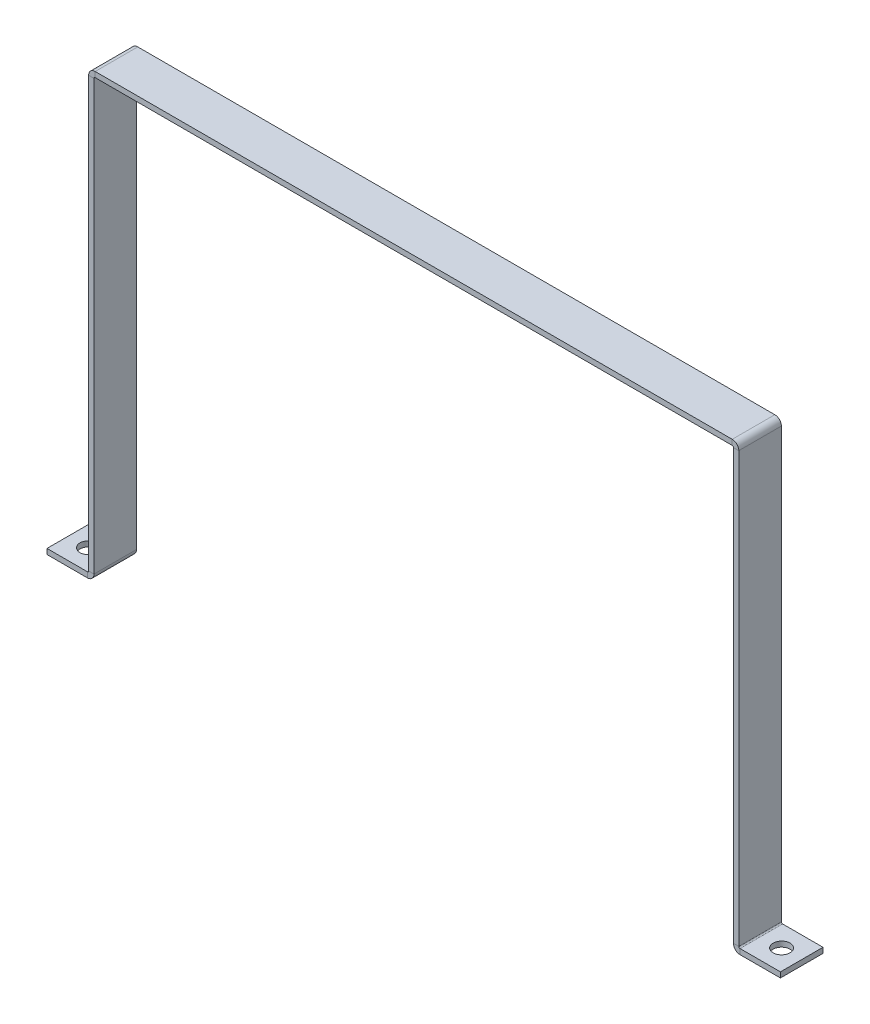
from build123d import *

# Parameters (mm, degrees)
CROQUIS1_W                    = 380
CROQUIS1_H                    = 3.175
BRIDA_BASE1_DEPTH             = 25.4
BRIDA_DE_ARISTA1_DEPTH        = 25.4
BRIDA_DE_ARISTA1_BEND_DEPTH   = 25.4
BRIDA_DE_ARISTA2_DEPTH        = 25.4
BRIDA_DE_ARISTA2_BEND_DEPTH   = 25.4
TALADRO_DE_MARGEN_PARA_3_81_D = 10.0838


# Sheet-metal steps are written as plain solids
with BuildPart() as part:
    # Croquis1 → Brida base1 (new body)
    with BuildSketch(Plane.XY):
        with Locations((113.920112782, -1.5875)):
            Rectangle(CROQUIS1_W, CROQUIS1_H)
    extrude(amount=BRIDA_BASE1_DEPTH)

    # Brida de arista1 section (across the edge) → Brida de arista1 (add)
    with BuildSketch(Plane(origin=(304.656712782, -3.175, 0), x_dir=(-1, 0, 0), z_dir=(0, 0, 1))):
        with BuildLine():
            Line((-3.175, 0.7366), (-3.175, 256.825))
            Line((-3.175, 256.825), (0, 256.825))
            Line((0, 256.825), (0, 0.7366))
            ThreePointArc((0, 0.7366), (0.215745145, 0.215745145), (0.7366, 0))
            Line((0.7366, 0), (0.7366, -3.175))
            ThreePointArc((0.7366, -3.175), (-2.029318885, -2.029318885), (-3.175, 0.7366))
        make_face()
    extrude(amount=BRIDA_DE_ARISTA1_DEPTH)

    # Brida de arista1 section 2 (across the edge) → Brida de arista1 bend (add)
    with BuildSketch(Plane(origin=(-76.816487218, -3.175, 25.4), x_dir=(1, 0, 0), z_dir=(0, 0, -1))):
        with BuildLine():
            Line((-3.175, 0.7366), (-3.175, 256.825))
            Line((-3.175, 256.825), (0, 256.825))
            Line((0, 256.825), (0, 0.7366))
            ThreePointArc((0, 0.7366), (0.215745145, 0.215745145), (0.7366, 0))
            Line((0.7366, 0), (0.7366, -3.175))
            ThreePointArc((0.7366, -3.175), (-2.029318885, -2.029318885), (-3.175, 0.7366))
        make_face()
    extrude(amount=BRIDA_DE_ARISTA1_BEND_DEPTH)

    # Brida de arista2 section (across the edge) → Brida de arista2 (add)
    with BuildSketch(Plane(origin=(307.831712782, -260.7366, 25.4), x_dir=(0, 1, 0), z_dir=(0, 0, -1))):
        with BuildLine():
            Line((-3.175, 0.7366), (-3.175, 24.825))
            Line((-3.175, 24.825), (0, 24.825))
            Line((0, 24.825), (0, 0.7366))
            ThreePointArc((0, 0.7366), (0.215745145, 0.215745145), (0.7366, 0))
            Line((0.7366, 0), (0.7366, -3.175))
            ThreePointArc((0.7366, -3.175), (-2.029318885, -2.029318885), (-3.175, 0.7366))
        make_face()
    extrude(amount=BRIDA_DE_ARISTA2_DEPTH)

    # Brida de arista2 section 2 (across the edge) → Brida de arista2 bend (add)
    with BuildSketch(Plane(origin=(-79.991487218, -260.7366, 0), x_dir=(0, 1, 0), z_dir=(0, 0, 1))):
        with BuildLine():
            Line((-3.175, 0.7366), (-3.175, 24.825))
            Line((-3.175, 24.825), (0, 24.825))
            Line((0, 24.825), (0, 0.7366))
            ThreePointArc((0, 0.7366), (0.215745145, 0.215745145), (0.7366, 0))
            Line((0.7366, 0), (0.7366, -3.175))
            ThreePointArc((0.7366, -3.175), (-2.029318885, -2.029318885), (-3.175, 0.7366))
        make_face()
    extrude(amount=BRIDA_DE_ARISTA2_BEND_DEPTH)

    # Taladro de margen para 3/81 (through all)
    with Locations(Plane(origin=(0, -263.9116, 0), x_dir=(-1, 0, 0), z_dir=(0, -1, 0))):
        with Locations((92.816487218, -12.7), (-320.656712782, -12.7)):
            Hole(TALADRO_DE_MARGEN_PARA_3_81_D / 2)


solid = part.part
